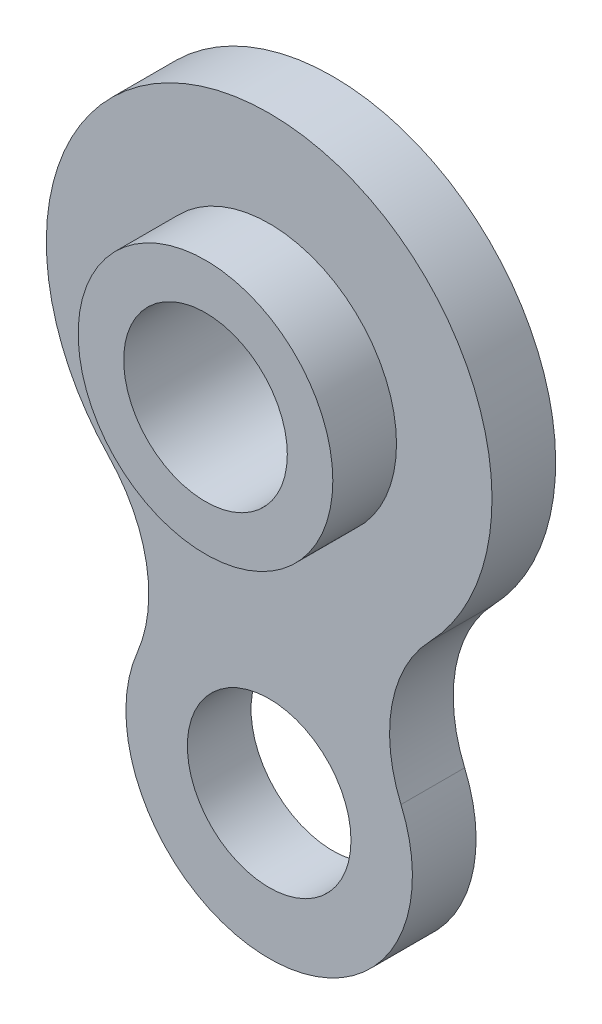
from build123d import *

# Parameters (mm, degrees)
SKETCH2_R           = 3.175
SKETCH2_R_2         = 2.0399375
BOSS_EXTRUDE1_DEPTH = 1.5875
SKETCH2_6_R         = 3.175
SKETCH2_6_R_2       = 2.0399375
BOSS_EXTRUDE2_DEPTH = 3.175


with BuildPart() as part:
    # Sketch2 → Boss-Extrude1 (new body)
    with BuildSketch(Plane.XY):
        with BuildLine():
            ThreePointArc((4.001636324, -3.8547141), (3.3e-08, 5.55625), (-4.001636369, -3.854714053))
            ThreePointArc((-4.001636369, -3.854714053), (-3.061446657, -5.68510333), (-3.28705844, -7.730434825))
            ThreePointArc((-3.28705844, -7.730434825), (3.2e-08, -12.7), (3.287058415, -7.730434766))
            ThreePointArc((3.287058415, -7.730434766), (3.061446657, -5.685103331), (4.001636324, -3.8547141))
        make_face()
        Circle(SKETCH2_R, mode=Mode.SUBTRACT)
        with Locations((0, -9.128125)):
            Circle(SKETCH2_R_2, mode=Mode.SUBTRACT)
    extrude(amount=BOSS_EXTRUDE1_DEPTH)

    # Sketch2<6> → Boss-Extrude2 (add)
    with BuildSketch(Plane.XY):
        Circle(SKETCH2_6_R)
        Circle(SKETCH2_6_R_2, mode=Mode.SUBTRACT)
    extrude(amount=BOSS_EXTRUDE2_DEPTH)


solid = part.part
